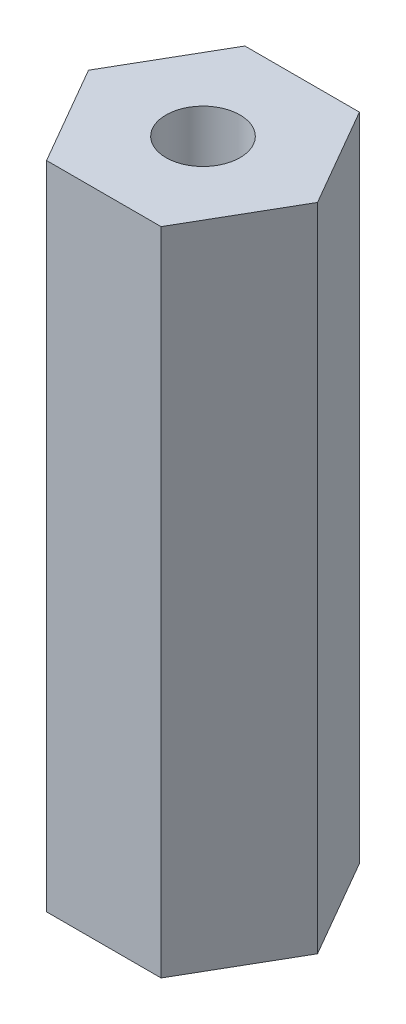
from build123d import *

# Parameters (mm, degrees)
BOSS_EXTRUDE1_DEPTH = 25.000000038
SKETCH2_R           = 1.4224
CUT_EXTRUDE1_DEPTH  = 26.668480709


with BuildPart() as part:
    # Sketch1 → Boss-Extrude1 (new body)
    with BuildSketch(Plane(origin=(0, 0, 0), x_dir=(1, 0, 0), z_dir=(0, 1, 0))):
        Polygon((4.399409051, 0), (2.199704526, 3.81), (-2.199704526, 3.81), (-4.399409051, 0), (-2.199704526, -3.81), (2.199704526, -3.81), align=None)
    extrude(amount=BOSS_EXTRUDE1_DEPTH)

    # Sketch2 → Cut-Extrude1 (cut, through all)
    with BuildSketch(Plane(origin=(0, 25.000000038, 0), x_dir=(1, 0, 0), z_dir=(0, 1, 0))):
        Circle(SKETCH2_R)
    extrude(amount=-CUT_EXTRUDE1_DEPTH, mode=Mode.SUBTRACT)


solid = part.part
